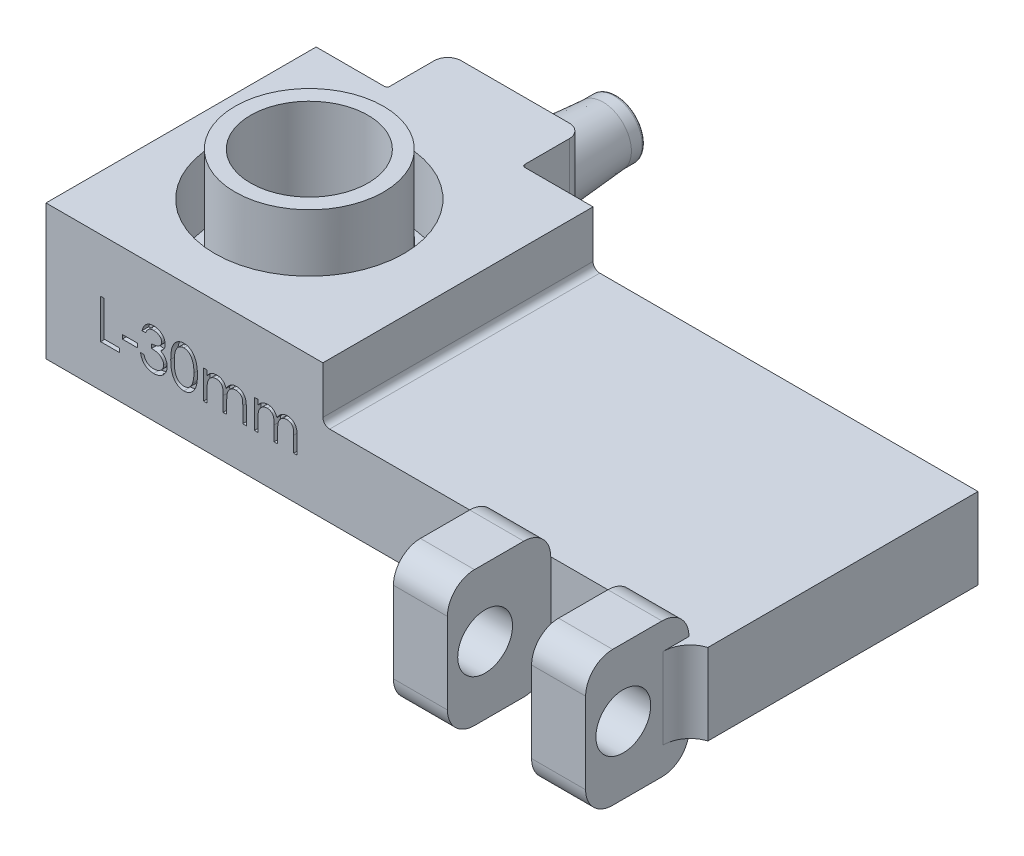
from build123d import *

# Parameters (mm, degrees)
SKETCH2_W            = 49
SKETCH2_H            = 20
BOSS_EXTRUDE1_DEPTH  = 10
SKETCH3_W            = 30
SKETCH3_H            = 3.02
CUT_EXTRUDE1_DEPTH   = 2
SKETCH4_W            = 5
SKETCH4_H            = 5
CUT_EXTRUDE2_DEPTH   = 5
SKETCH5_R            = 7
CUT_EXTRUDE3_DEPTH   = 38.474986727
SKETCH6_W            = 1.65
SKETCH6_H            = 5
BOSS_EXTRUDE2_DEPTH  = 0.5
SKETCH11_R           = 2
CUT_EXTRUDE4_DEPTH   = 2
SKETCH12_W           = 5
SKETCH12_H           = 5
BOSS_EXTRUDE4_DEPTH  = 0.8
SKETCH14_W           = 28.5
SKETCH14_H           = 4
CUT_EXTRUDE6_DEPTH   = 42.177221974
FILLET1_R            = 0.5
SKETCH13_W           = 1.119391026
SKETCH13_H           = 0.298504274
CUT_EXTRUDE5_DEPTH   = 0.5
SKETCH19_W           = 10
SKETCH19_H           = 4.49
BOSS_EXTRUDE5_DEPTH  = 10
FILLET2_R            = 1
CUT_EXTRUDE7_REACH   = 45.535
SKETCH20_R           = 0.5
SKETCH21_R           = 1.4
CUT_EXTRUDE8_DEPTH   = 10
FILLET3_R            = 0.2
BOSS_EXTRUDE6_START  = -0.5
SKETCH24_W           = 1.7
SKETCH24_H           = 3
BOSS_EXTRUDE6_DEPTH  = 0.5
SKETCH31_W           = 4
SKETCH31_H           = 10
BOSS_EXTRUDE9_DEPTH  = 7.65
CUT_EXTRUDE11_REACH  = 57.175
SKETCH33_R           = 2.03
FILLET4_R            = 2
FILLET5_R            = 2
SKETCH34_R           = 5.5
SKETCH34_R_2         = 4.35
BOSS_EXTRUDE10_DEPTH = 8.2


# Some blends are built 0.0001 mm under size
with BuildPart() as part:
    # Sketch2 → Boss-Extrude1 (new body)
    with BuildSketch(Plane(origin=(0, 0, 0), x_dir=(1, 0, 0), z_dir=(0, 1, 0))):
        with Locations((10.076923077, 3.557692308)):
            Rectangle(SKETCH2_W, SKETCH2_H)
    extrude(amount=BOSS_EXTRUDE1_DEPTH)

    # Sketch3 → Cut-Extrude1 (cut)
    with BuildSketch(Plane.XZ):
        with Locations((12.576923077, -3.557692308)):
            Rectangle(SKETCH3_W, SKETCH3_H)
    extrude(amount=-CUT_EXTRUDE1_DEPTH, mode=Mode.SUBTRACT)

    # Sketch4 → Cut-Extrude2 (cut)
    with BuildSketch(Plane.XZ):
        with Locations((-4.923076923, -3.547692308)):
            Rectangle(SKETCH4_W, SKETCH4_H)
    extrude(amount=-CUT_EXTRUDE2_DEPTH, mode=Mode.SUBTRACT)

    # Sketch5 → Cut-Extrude3 (cut, through all)
    with BuildSketch(Plane.XZ.offset(-5)):
        with Locations(Location((-4.923076923, -3.552692308, 0), (0, 0, 270))):
            Circle(SKETCH5_R)
    extrude(amount=-CUT_EXTRUDE3_DEPTH, mode=Mode.SUBTRACT)

    # Sketch6 → Boss-Extrude2 (add)
    with BuildSketch(Plane(origin=(0, 5, 0), x_dir=(1, 0, 0), z_dir=(0, 1, 0))):
        with Locations((-3.248076923, 3.547692308)):
            Rectangle(SKETCH6_W, SKETCH6_H)
        with Locations((-6.598076923, 3.547692308)):
            Rectangle(SKETCH6_W, SKETCH6_H)
    extrude(amount=-BOSS_EXTRUDE2_DEPTH)

    # Sketch11 → Cut-Extrude4 (cut)
    with BuildSketch(Plane.XZ):
        with Locations((28.888372657, -3.557692308)):
            Circle(SKETCH11_R)
    extrude(amount=-CUT_EXTRUDE4_DEPTH, mode=Mode.SUBTRACT)

    # Sketch12 → Boss-Extrude4 (add)
    with BuildSketch(Plane.XZ):
        with Locations((-4.923076923, -3.547692308)):
            Rectangle(SKETCH12_W, SKETCH12_H)
    extrude(amount=-BOSS_EXTRUDE4_DEPTH)

    # Sketch14 → Cut-Extrude6 (cut, through all)
    with BuildSketch(Plane.XY.offset(6.442307692)):
        with Locations((20.326923077, 8)):
            Rectangle(SKETCH14_W, SKETCH14_H)
    extrude(amount=-CUT_EXTRUDE6_DEPTH, mode=Mode.SUBTRACT)

    # Fillet1
    fillet1_edges = [part.edges().sort_by_distance(p)[0] for p in [
        (6.076923077, 6, -3.557692308),
    ]]
    fillet(fillet1_edges, radius=FILLET1_R)

    # Sketch13 → Cut-Extrude5 (cut)
    # profile 1 of 6: a face of its own
    with BuildSketch(Plane.XY.offset(6.442307692)):
        Polygon((-10.374825021, 6.036177607), (-10.113633781, 6.036177607), (-10.113633781, 3.424265214), (-8.994242756, 3.424265214), (-8.994242756, 3.12576094), (-10.374825021, 3.12576094), align=None)
    # profile 2 of 6: a face of its own
    with BuildSketch(Plane.XY.offset(6.442307692)):
        with Locations((-8.210669038, 4.245151966)):
            Rectangle(SKETCH13_W, SKETCH13_H)
    # profile 3 of 6: a face of its own
    with BuildSketch(Plane.XY.offset(6.442307692)):
        with BuildLine():
            Line((-7.053964978, 5.364542992), (-7.315156217, 5.364542992))
            add(Edge.make_bspline(
                [(-7.315156217, 5.364542992), (-7.308080121, 5.39384048), (-7.294246931, 5.451114673), (-7.265394246, 5.532944996), (-7.233962365, 5.610381639), (-7.196219163, 5.681974624), (-7.155050277, 5.749162759), (-7.107882633, 5.810422144), (-7.056892363, 5.867310783), (-7.000492688, 5.917796731), (-6.941345819, 5.963513331), (-6.878618341, 6.002492173), (-6.81357228, 6.036023626), (-6.745756966, 6.063647831), (-6.674970501, 6.084457746), (-6.601852832, 6.099555994), (-6.52621235, 6.109360867), (-6.474866288, 6.110317781), (-6.448794205, 6.110803675)],
                knots=[0, 0, 0, 0, 1.162005537, 2.271625781, 3.343758855, 4.383309926, 5.390229558, 6.379919256, 7.361854164, 8.333198761, 9.295911338, 10.242430842, 11.177959212, 12.116337295, 13.062827104, 14.020064771, 14.994644689, 16, 16, 16, 16], degree=3))
            add(Edge.make_bspline(
                [(-6.448794205, 6.110803675), (-6.410806829, 6.10965678), (-6.335660693, 6.107388006), (-6.225261898, 6.086670465), (-6.118801501, 6.05388659), (-6.017444787, 6.008589092), (-5.923298269, 5.952719642), (-5.839531333, 5.886225155), (-5.767279399, 5.810388593), (-5.706664253, 5.726624669), (-5.659203673, 5.637103987), (-5.624206849, 5.54496838), (-5.602901202, 5.450436407), (-5.60014, 5.386609075), (-5.598756645, 5.354631717)],
                knots=[0, 0, 0, 0, 1.083050992, 2.142477498, 3.193116406, 4.255571735, 5.30263384, 6.308962982, 7.297363603, 8.282367274, 9.249857812, 10.179914175, 11.08814088, 12, 12, 12, 12], degree=3))
            add(Edge.make_bspline(
                [(-5.598756645, 5.354631717), (-5.599724226, 5.323858805), (-5.601617633, 5.263640992), (-5.617694529, 5.175728532), (-5.644749981, 5.092871797), (-5.682227635, 5.014721985), (-5.730741412, 4.941774604), (-5.789509125, 4.873865526), (-5.858945565, 4.810693554), (-5.911565015, 4.77450504), (-5.938655065, 4.755874122)],
                knots=[0, 0, 0, 0, 1.024540389, 2.004866551, 2.965041327, 3.920577974, 4.882998113, 5.874504559, 6.905732034, 8, 8, 8, 8], degree=3))
            add(Edge.make_bspline(
                [(-5.938655065, 4.755874122), (-5.907695089, 4.740924416), (-5.84635442, 4.711304725), (-5.762741866, 4.653216336), (-5.686839967, 4.586146742), (-5.6445111, 4.533806929), (-5.623243323, 4.507509238)],
                knots=[0, 0, 0, 0, 1.015518401, 2.012035669, 3.001164323, 4, 4, 4, 4], degree=3))
            add(Edge.make_bspline(
                [(-5.623243323, 4.507509238), (-5.609238945, 4.488335619), (-5.58145952, 4.450302364), (-5.54717021, 4.389153324), (-5.51606275, 4.32732652), (-5.491822955, 4.2631648), (-5.47305171, 4.197411823), (-5.459633831, 4.129954688), (-5.45129828, 4.060738309), (-5.45010455, 4.0139118), (-5.449504508, 3.990373905)],
                knots=[0, 0, 0, 0, 1.025084078, 2.033381695, 3.024893161, 4.013698104, 4.991890475, 5.976764909, 6.982997093, 8, 8, 8, 8], degree=3))
            add(Edge.make_bspline(
                [(-5.449504508, 3.990373905), (-5.450996731, 3.949619988), (-5.453974156, 3.868303942), (-5.480587068, 3.748166331), (-5.52184284, 3.630730601), (-5.580431137, 3.51840944), (-5.65183406, 3.413318135), (-5.736782739, 3.3192898), (-5.834311973, 3.238464532), (-5.943083099, 3.17093436), (-6.06092764, 3.116952016), (-6.186969962, 3.079484607), (-6.319393965, 3.055082011), (-6.410205034, 3.05246524), (-6.456373415, 3.051134872)],
                knots=[0, 0, 0, 0, 0.955779014, 1.907060117, 2.875433937, 3.871313158, 4.872415639, 5.851225146, 6.836215519, 7.83643374, 8.849228613, 9.86973379, 10.916971861, 12, 12, 12, 12], degree=3))
            add(Edge.make_bspline(
                [(-6.456373415, 3.051134872), (-6.487489345, 3.051856833), (-6.548715119, 3.053277411), (-6.638724743, 3.062988724), (-6.724641656, 3.080725639), (-6.806582024, 3.104593804), (-6.88461864, 3.13485527), (-6.958513375, 3.172539926), (-7.028720852, 3.216870978), (-7.094578551, 3.268371706), (-7.156078622, 3.325982439), (-7.211586691, 3.390725913), (-7.262028198, 3.461405302), (-7.306052523, 3.538841558), (-7.345664917, 3.622033953), (-7.378245749, 3.712047734), (-7.406922141, 3.808078198), (-7.42025473, 3.874999271), (-7.42709532, 3.909334658)],
                knots=[0, 0, 0, 0, 1.048658725, 2.063410685, 3.046034179, 4.001477787, 4.936774919, 5.862367409, 6.792675028, 7.730719943, 8.675894397, 9.627829632, 10.600096036, 11.597688215, 12.626045268, 13.701542398, 14.82072376, 16, 16, 16, 16], degree=3))
            Line((-7.42709532, 3.909334658), (-7.16590408, 3.909334658))
            add(Edge.make_bspline(
                [(-7.16590408, 3.909334658), (-7.159099284, 3.886925271), (-7.145863364, 3.843337065), (-7.123333165, 3.780604858), (-7.097664727, 3.723096644), (-7.070128394, 3.67039056), (-7.04120846, 3.621967544), (-7.008848847, 3.579108025), (-6.97544629, 3.539929491), (-6.950267566, 3.517856382), (-6.937944762, 3.507053509)],
                knots=[0, 0, 0, 0, 1.198163088, 2.33053128, 3.407730985, 4.417276592, 5.372219308, 6.28897303, 7.162600585, 8, 8, 8, 8], degree=3))
            add(Edge.make_bspline(
                [(-6.937944762, 3.507053509), (-6.921649276, 3.494490209), (-6.889108603, 3.469402391), (-6.836082282, 3.437386454), (-6.780314636, 3.409645173), (-6.720597315, 3.388454266), (-6.658218961, 3.370511414), (-6.592171324, 3.35876953), (-6.523037106, 3.350713354), (-6.475832008, 3.350002438), (-6.451709285, 3.349639146)],
                knots=[0, 0, 0, 0, 0.946170439, 1.889420265, 2.845303464, 3.807233317, 4.801018734, 5.828864929, 6.890507805, 8, 8, 8, 8], degree=3))
            add(Edge.make_bspline(
                [(-6.451709285, 3.349639146), (-6.424473188, 3.3501513), (-6.371215352, 3.351152774), (-6.293503186, 3.360362752), (-6.219572409, 3.373775959), (-6.150243852, 3.39449229), (-6.084609376, 3.420088034), (-6.02358904, 3.452226023), (-5.966381802, 3.489932319), (-5.913720385, 3.532789583), (-5.866367484, 3.579706743), (-5.824674091, 3.628778922), (-5.789229656, 3.679799216), (-5.760638073, 3.733049963), (-5.738061098, 3.78831065), (-5.722691436, 3.845736356), (-5.712004789, 3.904857118), (-5.711134482, 3.945044957), (-5.710695747, 3.96530421)],
                knots=[0, 0, 0, 0, 1.217147791, 2.380027433, 3.494444702, 4.572153297, 5.609568379, 6.639424714, 7.649109417, 8.668170816, 9.669597737, 10.625200337, 11.543417969, 12.441394052, 13.322311151, 14.205496177, 15.095365482, 16, 16, 16, 16], degree=3))
            add(Edge.make_bspline(
                [(-5.710695747, 3.96530421), (-5.711968266, 3.992422091), (-5.714506971, 4.046522918), (-5.733889165, 4.126116639), (-5.765769756, 4.202804798), (-5.810401005, 4.275278988), (-5.864730775, 4.342447997), (-5.928231831, 4.402378866), (-6.001431495, 4.451831079), (-6.068803374, 4.485998253), (-6.128479519, 4.509312417), (-6.179549336, 4.524841539), (-6.236723726, 4.537991347), (-6.299311279, 4.550225301), (-6.367783584, 4.560637398), (-6.442066097, 4.569320265), (-6.522173871, 4.57626788), (-6.577630751, 4.579370463), (-6.606208568, 4.580969274)],
                knots=[0, 0, 0, 0, 1.07054697, 2.135767047, 3.216561865, 4.33974944, 5.486079747, 6.621378074, 7.775625952, 8.963672916, 9.598146892, 10.304877434, 11.070270905, 11.915000392, 12.823868403, 13.805723172, 14.86925407, 16, 16, 16, 16], degree=3))
            Line((-6.606208568, 4.580969274), (-6.606208568, 4.879473547))
            add(Edge.make_bspline(
                [(-6.606208568, 4.879473547), (-6.570201586, 4.880084572), (-6.499672755, 4.881281418), (-6.396648741, 4.895757008), (-6.298132541, 4.915781197), (-6.206307446, 4.94645299), (-6.122613248, 4.982076737), (-6.050002841, 5.023531223), (-5.989493493, 5.069611226), (-5.941379257, 5.121027985), (-5.90518263, 5.176172105), (-5.878717133, 5.233645897), (-5.863083766, 5.293953107), (-5.860996859, 5.335110281), (-5.859947884, 5.355797749)],
                knots=[0, 0, 0, 0, 1.321986639, 2.589447074, 3.816329219, 5.01088745, 6.139805852, 7.153945165, 8.075214402, 8.924034688, 9.728124013, 10.488707548, 11.240355623, 12, 12, 12, 12], degree=3))
            add(Edge.make_bspline(
                [(-5.859947884, 5.355797749), (-5.860292486, 5.370996565), (-5.860978057, 5.401233887), (-5.869623888, 5.445409912), (-5.882616022, 5.488235401), (-5.90047744, 5.529528235), (-5.924384599, 5.569002028), (-5.952994815, 5.606993317), (-5.987061742, 5.643285198), (-6.026099116, 5.677112821), (-6.068018933, 5.709351287), (-6.113961752, 5.736720544), (-6.162542322, 5.760124503), (-6.21381443, 5.779424309), (-6.267944463, 5.793942539), (-6.324678095, 5.804366688), (-6.384123508, 5.810884071), (-6.424679526, 5.811822403), (-6.445296108, 5.812299402)],
                knots=[0, 0, 0, 0, 0.884392785, 1.759457502, 2.611959086, 3.489218968, 4.37281399, 5.2945488, 6.255912374, 7.266815255, 8.301784654, 9.332968512, 10.37626691, 11.440494194, 12.520033166, 13.637162961, 14.798855837, 16, 16, 16, 16], degree=3))
            add(Edge.make_bspline(
                [(-6.445296108, 5.812299402), (-6.478434667, 5.811142418), (-6.543161982, 5.80888256), (-6.636474029, 5.789089221), (-6.723220523, 5.757508636), (-6.789527021, 5.719812071), (-6.838490685, 5.682599955), (-6.873479663, 5.650101089), (-6.907839635, 5.613984628), (-6.939310118, 5.572026086), (-6.971136752, 5.527066976), (-7.000111664, 5.476821807), (-7.02826761, 5.422601248), (-7.045233302, 5.384270533), (-7.053964978, 5.364542992)],
                knots=[0, 0, 0, 0, 1.472543308, 2.876219568, 4.221790263, 5.565193594, 6.249813518, 6.953379497, 7.687249741, 8.463570142, 9.283606569, 10.136032583, 11.040678096, 12, 12, 12, 12], degree=3))
        make_face()
    # profile 4 of 6: a face of its own
    with BuildSketch(Plane.XY.offset(6.442307692)):
        with BuildLine():
            add(Edge.make_bspline(
                [(-5.188313269, 4.579803241), (-5.188040506, 4.626450891), (-5.18751066, 4.717064622), (-5.181616301, 4.849101613), (-5.171824543, 4.972969186), (-5.158405549, 5.088673272), (-5.142075633, 5.196243739), (-5.120276208, 5.295393117), (-5.095485443, 5.386580302), (-5.066753439, 5.470102648), (-5.034333236, 5.547085417), (-4.999047127, 5.618952087), (-4.959494735, 5.68559392), (-4.917936553, 5.748074571), (-4.872690324, 5.805371274), (-4.825043651, 5.858293179), (-4.773136889, 5.905617178), (-4.718734542, 5.948729847), (-4.661344065, 5.986523247), (-4.602601324, 6.019812376), (-4.542101989, 6.048251194), (-4.479680884, 6.070611872), (-4.415899054, 6.089081248), (-4.350533535, 6.101711582), (-4.283476401, 6.109658606), (-4.238214071, 6.110418364), (-4.215259299, 6.110803675)],
                knots=[0, 0, 0, 0, 1.646270934, 3.197905019, 4.663502075, 6.030701355, 7.308322542, 8.50163776, 9.611534131, 10.641858119, 11.616356847, 12.558055219, 13.465016945, 14.349605745, 15.204443733, 16.039544428, 16.859896111, 17.680448484, 18.487036065, 19.28249412, 20.06191084, 20.843045899, 21.620316918, 22.403196591, 23.190181807, 24, 24, 24, 24], degree=3))
            add(Edge.make_bspline(
                [(-4.215259299, 6.110803675), (-4.192112773, 6.110398034), (-4.146081616, 6.109591341), (-4.078027446, 6.101838038), (-4.011545479, 6.088973063), (-3.946919146, 6.070744729), (-3.883617594, 6.048130228), (-3.822135951, 6.019785167), (-3.762092324, 5.9867903), (-3.704440888, 5.948020325), (-3.648548735, 5.904794587), (-3.595788733, 5.85593063), (-3.546156078, 5.801921846), (-3.499027863, 5.743346081), (-3.455741155, 5.679079853), (-3.414518486, 5.610240924), (-3.377621025, 5.535625437), (-3.342085107, 5.456478345), (-3.311411821, 5.370609696), (-3.283749354, 5.278503523), (-3.261398212, 5.179071893), (-3.242780466, 5.072836491), (-3.228357359, 4.959407173), (-3.217852716, 4.839027088), (-3.212303728, 4.711617037), (-3.211258721, 4.624505897), (-3.210722457, 4.579803241)],
                knots=[0, 0, 0, 0, 0.810914788, 1.612654377, 2.396697861, 3.181598691, 3.963628158, 4.749916497, 5.551656086, 6.361998678, 7.18212741, 8.025565596, 8.878627764, 9.750805457, 10.657531673, 11.591944965, 12.560506719, 13.57287815, 14.630710178, 15.753379473, 16.941251878, 18.199788006, 19.531962791, 20.947069417, 22.433333509, 24, 24, 24, 24], degree=3))
            add(Edge.make_bspline(
                [(-3.210722457, 4.579803241), (-3.21126428, 4.535295563), (-3.212320001, 4.448574167), (-3.217790509, 4.321737398), (-3.228566228, 4.201996168), (-3.242045605, 4.089063301), (-3.26071465, 3.983408841), (-3.28366966, 3.884667177), (-3.309156863, 3.792411899), (-3.340618296, 3.707398785), (-3.375053274, 3.628441906), (-3.412518815, 3.554710949), (-3.452657474, 3.485554217), (-3.49638752, 3.421525261), (-3.542998602, 3.362170508), (-3.593488335, 3.308537664), (-3.646433458, 3.259334432), (-3.702490092, 3.215552097), (-3.76104065, 3.177230387), (-3.820878049, 3.142959108), (-3.883063993, 3.11532454), (-3.946189228, 3.091596294), (-4.011156685, 3.07346818), (-4.07788538, 3.060933552), (-4.146035893, 3.052142556), (-4.192104933, 3.05147193), (-4.215259299, 3.051134872)],
                knots=[0, 0, 0, 0, 1.561518951, 3.042555995, 4.452378317, 5.7783523, 7.031515105, 8.214008947, 9.334062868, 10.386615937, 11.391082383, 12.354592575, 13.286541444, 14.194233754, 15.072674879, 15.931287219, 16.775624067, 17.606195743, 18.42308326, 19.229000347, 20.022332153, 20.807536673, 21.593273796, 22.3848459, 23.188221202, 24, 24, 24, 24], degree=3))
            add(Edge.make_bspline(
                [(-4.215259299, 3.051134872), (-4.238213434, 3.051522669), (-4.283474508, 3.052287328), (-4.350540841, 3.060198449), (-4.41563642, 3.072917388), (-4.479082467, 3.090726315), (-4.541204492, 3.112525199), (-4.601155988, 3.140925614), (-4.659603544, 3.173633765), (-4.716391225, 3.210883291), (-4.770451932, 3.253559714), (-4.82208988, 3.300761924), (-4.870007827, 3.35366782), (-4.914607132, 3.411442021), (-4.956994513, 3.473553009), (-4.99598526, 3.540848805), (-5.03205019, 3.613062571), (-5.065015641, 3.690660857), (-5.094243428, 3.774775997), (-5.120061076, 3.866370284), (-5.140445765, 3.966252155), (-5.157894092, 4.073619394), (-5.171967522, 4.188933371), (-5.181575494, 4.312256688), (-5.187513837, 4.443512495), (-5.188041929, 4.533543968), (-5.188313269, 4.579803241)],
                knots=[0, 0, 0, 0, 0.810891512, 1.598919785, 2.382837074, 3.152667961, 3.926044502, 4.706494248, 5.493654104, 6.291793342, 7.103789334, 7.925228297, 8.761435821, 9.622817696, 10.50288917, 11.416980706, 12.369136599, 13.353924996, 14.394355917, 15.514179734, 16.714354668, 17.994756427, 19.357759367, 20.818452758, 22.365282078, 24, 24, 24, 24], degree=3))
        make_face()
        with BuildLine():
            add(Edge.make_bspline(
                [(-4.927122029, 4.580969274), (-4.927022703, 4.542095505), (-4.926829931, 4.466649152), (-4.921793912, 4.357015202), (-4.914933451, 4.254759518), (-4.906084706, 4.159752262), (-4.892943802, 4.072315019), (-4.878219764, 3.99184642), (-4.860301502, 3.918772312), (-4.83910118, 3.852591258), (-4.814953788, 3.792180098), (-4.788588853, 3.735966468), (-4.76026574, 3.683286317), (-4.728567851, 3.634612834), (-4.694046099, 3.589787291), (-4.65748024, 3.548016299), (-4.617505597, 3.510765476), (-4.562204568, 3.466089038), (-4.489197619, 3.419922234), (-4.397211443, 3.379720158), (-4.302690713, 3.354455699), (-4.238535775, 3.351242802), (-4.206514056, 3.349639146)],
                knots=[0, 0, 0, 0, 1.459021318, 2.831673884, 4.118529203, 5.306027144, 6.411944654, 7.436330062, 8.375795394, 9.233974572, 10.042671642, 10.816086306, 11.563610507, 12.285937304, 12.993564865, 13.685989202, 14.367179055, 15.041617293, 16.353048772, 17.594441528, 18.799311195, 20, 20, 20, 20], degree=3))
            add(Edge.make_bspline(
                [(-4.206514056, 3.349639146), (-4.174285207, 3.350967776), (-4.109894048, 3.353622295), (-4.01581791, 3.379232912), (-3.924488811, 3.417874547), (-3.852915894, 3.463566014), (-3.798464041, 3.507079512), (-3.759450329, 3.544178716), (-3.723642185, 3.585719399), (-3.689680055, 3.63053923), (-3.65853105, 3.679494504), (-3.630205929, 3.732349812), (-3.604358645, 3.789251932), (-3.58963273, 3.828974745), (-3.58210375, 3.849283994)],
                knots=[0, 0, 0, 0, 1.353760809, 2.704726607, 4.075137775, 5.516104923, 6.260822281, 7.007110065, 7.778089737, 8.566572457, 9.372053459, 10.217411131, 11.088608312, 12, 12, 12, 12], degree=3))
            add(Edge.make_bspline(
                [(-3.58210375, 3.849283994), (-3.573329453, 3.875253009), (-3.555513866, 3.927981248), (-3.532553361, 4.009775309), (-3.514471026, 4.095593321), (-3.498203156, 4.184922421), (-3.487099454, 4.278421387), (-3.478162135, 4.375800922), (-3.472897868, 4.477134447), (-3.47224531, 4.545982425), (-3.471913696, 4.580969274)],
                knots=[0, 0, 0, 0, 0.884706709, 1.796334032, 2.740027952, 3.714592787, 4.726048262, 5.777819803, 6.87074269, 8, 8, 8, 8], degree=3))
            add(Edge.make_bspline(
                [(-3.471913696, 4.580969274), (-3.472371204, 4.615950464), (-3.473266189, 4.684381149), (-3.476687166, 4.784597755), (-3.485521174, 4.879783149), (-3.495332703, 4.970347393), (-3.509799321, 5.055789163), (-3.52539733, 5.136823732), (-3.546353338, 5.212447188), (-3.568738413, 5.283843519), (-3.594358724, 5.350201563), (-3.622561272, 5.411830705), (-3.65268139, 5.46902848), (-3.685396336, 5.521637954), (-3.720317746, 5.569894777), (-3.758367327, 5.612831401), (-3.798035785, 5.651778571), (-3.853597457, 5.696235243), (-3.926336494, 5.741564313), (-4.016846833, 5.783279531), (-4.111036768, 5.807234999), (-4.174711241, 5.810612485), (-4.206514056, 5.812299402)],
                knots=[0, 0, 0, 0, 1.31362396, 2.569729283, 3.763502607, 4.902122613, 5.988968491, 7.01645872, 7.998833611, 8.933434873, 9.825090667, 10.667526885, 11.477055099, 12.250526234, 12.991942729, 13.710640831, 14.402115721, 15.076753259, 16.378508321, 17.609869233, 18.806226677, 20, 20, 20, 20], degree=3))
            add(Edge.make_bspline(
                [(-4.206514056, 5.812299402), (-4.238703757, 5.810610157), (-4.3031418, 5.807228591), (-4.398310725, 5.783368784), (-4.489535117, 5.741780621), (-4.562081805, 5.696085107), (-4.617682227, 5.652563309), (-4.656833729, 5.614822311), (-4.693543373, 5.573539086), (-4.727360503, 5.528301303), (-4.759033555, 5.479684566), (-4.788121933, 5.427306409), (-4.814330094, 5.3709014), (-4.83851527, 5.310517376), (-4.859780261, 5.244342031), (-4.877320896, 5.171357933), (-4.893525309, 5.091145277), (-4.904996732, 5.003234472), (-4.915194629, 4.908203419), (-4.921748345, 4.805692459), (-4.926846777, 4.695874637), (-4.927028441, 4.620038194), (-4.927122029, 4.580969274)],
                knots=[0, 0, 0, 0, 1.207732386, 2.417664972, 3.655092373, 4.956220595, 5.625982001, 6.301752483, 6.994047911, 7.697131622, 8.419323945, 9.170223765, 9.943494443, 10.752040957, 11.610060368, 12.549350801, 13.567764191, 14.679664412, 15.874934091, 17.154273443, 18.533957287, 20, 20, 20, 20], degree=3))
        make_face(mode=Mode.SUBTRACT)
    # profile 5 of 6: a face of its own
    with BuildSketch(Plane.XY.offset(6.442307692)):
        with BuildLine():
            Line((-2.762966046, 5.252603889), (-2.501774807, 5.252603889))
            Line((-2.501774807, 5.252603889), (-2.501774807, 4.882971644))
            add(Edge.make_bspline(
                [(-2.501774807, 4.882971644), (-2.478255356, 4.915308537), (-2.433189832, 4.977269123), (-2.359293811, 5.05891902), (-2.285472246, 5.128210349), (-2.232308594, 5.16458463), (-2.20676863, 5.182058934)],
                knots=[0, 0, 0, 0, 1.134379233, 2.173579362, 3.122582517, 4, 4, 4, 4], degree=3))
            add(Edge.make_bspline(
                [(-2.20676863, 5.182058934), (-2.17195617, 5.198694348), (-2.102939464, 5.231674535), (-1.993658121, 5.265130655), (-1.88183603, 5.285690755), (-1.806324675, 5.288502528), (-1.768340479, 5.289916923)],
                knots=[0, 0, 0, 0, 1.014936303, 2.012140481, 3.000054389, 4, 4, 4, 4], degree=3))
            add(Edge.make_bspline(
                [(-1.768340479, 5.289916923), (-1.742651481, 5.289047714), (-1.691814336, 5.287327596), (-1.616489351, 5.276134936), (-1.543430732, 5.256788005), (-1.473070137, 5.229839772), (-1.406778596, 5.197204283), (-1.346001448, 5.158911758), (-1.291431794, 5.115923178), (-1.243097214, 5.066297304), (-1.199633031, 5.00864062), (-1.15965318, 4.941398147), (-1.122711501, 4.86305999), (-1.10223771, 4.806209956), (-1.091458718, 4.776279687)],
                knots=[0, 0, 0, 0, 1.009824226, 1.998387844, 2.986035974, 3.974953746, 4.955485308, 5.885931332, 6.793869504, 7.679848016, 8.601185859, 9.625726857, 10.749998409, 12, 12, 12, 12], degree=3))
            add(Edge.make_bspline(
                [(-1.091458718, 4.776279687), (-1.080057159, 4.796839219), (-1.057620494, 4.837297491), (-1.019946699, 4.894556415), (-0.980474966, 4.948113729), (-0.938868902, 4.998011928), (-0.895275362, 5.044004603), (-0.849489186, 5.086243814), (-0.801771007, 5.124910956), (-0.73541996, 5.17008325), (-0.649094834, 5.21806453), (-0.540255134, 5.259665564), (-0.427039783, 5.285373797), (-0.350190066, 5.288392541), (-0.311383097, 5.289916923)],
                knots=[0, 0, 0, 0, 0.86119277, 1.694706429, 2.50939023, 3.298075842, 4.073795165, 4.829715201, 5.57930267, 6.321991688, 7.768977793, 9.186738141, 10.579381044, 12, 12, 12, 12], degree=3))
            add(Edge.make_bspline(
                [(-0.311383097, 5.289916923), (-0.275725119, 5.288572127), (-0.205938993, 5.285940231), (-0.104342778, 5.265273384), (-0.009594742, 5.229784888), (0.07811447, 5.181360846), (0.157244386, 5.120508871), (0.226026936, 5.048106986), (0.284044316, 4.964667317), (0.321945125, 4.886175883), (0.347652639, 4.816878586), (0.363502963, 4.757833473), (0.377505972, 4.692846735), (0.389132043, 4.621840667), (0.397629256, 4.544564441), (0.403924666, 4.461144518), (0.408185577, 4.371516065), (0.408486658, 4.309677611), (0.40864186, 4.277800871)],
                knots=[0, 0, 0, 0, 1.209669288, 2.367440248, 3.500751976, 4.631527125, 5.755587489, 6.87532382, 8.007944318, 9.190864318, 9.82315674, 10.514484317, 11.263564316, 12.079023757, 12.955305781, 13.901327259, 14.918167583, 16, 16, 16, 16], degree=3))
            Line((0.40864186, 4.277800871), (0.40864186, 3.12576094))
            Line((0.40864186, 3.12576094), (0.14745062, 3.12576094))
            Line((0.14745062, 3.12576094), (0.14745062, 4.278966903))
            add(Edge.make_bspline(
                [(0.14745062, 4.278966903), (0.147385857, 4.306175619), (0.147261392, 4.358466632), (0.145021509, 4.433515843), (0.140801143, 4.501925899), (0.135866209, 4.563603522), (0.129011089, 4.618692545), (0.120158489, 4.667082312), (0.110780561, 4.709153475), (0.095200693, 4.755791695), (0.070297595, 4.807239721), (0.032364488, 4.862723551), (-0.015424642, 4.911020502), (-0.070606272, 4.952945734), (-0.133428402, 4.987033898), (-0.202666984, 5.011378295), (-0.277892151, 5.026448331), (-0.329965981, 5.027950119), (-0.356858357, 5.028725684)],
                knots=[0, 0, 0, 0, 1.253487763, 2.409012846, 3.458416907, 4.410876679, 5.259312806, 6.014470957, 6.676830364, 7.243083969, 8.276244668, 9.299465089, 10.325150304, 11.392391894, 12.482080715, 13.603491619, 14.762376348, 16, 16, 16, 16], degree=3))
            add(Edge.make_bspline(
                [(-0.356858357, 5.028725684), (-0.389845813, 5.027548082), (-0.455041568, 5.025220692), (-0.550208439, 5.001460156), (-0.641654576, 4.965636876), (-0.726651327, 4.913721315), (-0.804839912, 4.851514598), (-0.872111763, 4.777548774), (-0.927685908, 4.693870197), (-0.965316744, 4.616414279), (-0.989090109, 4.546839152), (-1.004787164, 4.486055206), (-1.016997103, 4.416968926), (-1.028447954, 4.340044543), (-1.035921678, 4.254752553), (-1.042714068, 4.161487502), (-1.045891298, 4.059968876), (-1.046335725, 3.989597755), (-1.046566474, 3.95306087)],
                knots=[0, 0, 0, 0, 1.090531906, 2.155305635, 3.229839962, 4.33261226, 5.44038871, 6.529323825, 7.629011124, 8.757537029, 9.370236727, 10.061839251, 10.834451254, 11.692844982, 12.636905849, 13.66920014, 14.789842145, 16, 16, 16, 16], degree=3))
            Line((-1.046566474, 3.95306087), (-1.046566474, 3.12576094))
            Line((-1.046566474, 3.12576094), (-1.307757713, 3.12576094))
            Line((-1.307757713, 3.12576094), (-1.307757713, 4.207255916))
            add(Edge.make_bspline(
                [(-1.307757713, 4.207255916), (-1.307823764, 4.237768158), (-1.307950838, 4.296470644), (-1.310176324, 4.380651266), (-1.314406092, 4.457221069), (-1.319296048, 4.52609106), (-1.326331089, 4.587136075), (-1.334322064, 4.640683383), (-1.343758974, 4.686598741), (-1.359383658, 4.736960079), (-1.383261106, 4.792441704), (-1.421668845, 4.851598851), (-1.469572291, 4.903377739), (-1.525760692, 4.94758177), (-1.588963036, 4.984121204), (-1.658799233, 5.010447795), (-1.734640461, 5.025768469), (-1.786926268, 5.027721356), (-1.813815739, 5.028725684)],
                knots=[0, 0, 0, 0, 1.320475261, 2.540461679, 3.643808994, 4.639130445, 5.527981419, 6.302341397, 6.981980563, 7.553956391, 8.582137848, 9.585246428, 10.591171744, 11.620968678, 12.668337649, 13.738356861, 14.836885341, 16, 16, 16, 16], degree=3))
            add(Edge.make_bspline(
                [(-1.813815739, 5.028725684), (-1.845428029, 5.027453034), (-1.908430201, 5.024916687), (-2.000983089, 5.002087151), (-2.090362553, 4.966327215), (-2.17514274, 4.916717234), (-2.253037255, 4.855266631), (-2.321231034, 4.782992757), (-2.378560027, 4.700795078), (-2.416588209, 4.624155894), (-2.441117595, 4.556323831), (-2.457412049, 4.498655216), (-2.471415, 4.434625843), (-2.481821005, 4.364038168), (-2.491866446, 4.287351936), (-2.496714625, 4.204185126), (-2.501430799, 4.11460908), (-2.501657325, 4.052764767), (-2.501774807, 4.020690745)],
                knots=[0, 0, 0, 0, 1.098833095, 2.189935336, 3.297829714, 4.440610912, 5.596351641, 6.740013378, 7.886572111, 9.072425424, 9.705826452, 10.395263256, 11.156850408, 11.985370555, 12.878090359, 13.847760091, 14.883794034, 16, 16, 16, 16], degree=3))
            Line((-2.501774807, 4.020690745), (-2.501774807, 3.12576094))
            Line((-2.501774807, 3.12576094), (-2.762966046, 3.12576094))
            Line((-2.762966046, 3.12576094), (-2.762966046, 5.252603889))
        make_face()
    # profile 6 of 6: a face of its own
    with BuildSketch(Plane.XY.offset(6.442307692)):
        with BuildLine():
            Line((1.005650407, 5.252603889), (1.266841646, 5.252603889))
            Line((1.266841646, 5.252603889), (1.266841646, 4.882971644))
            add(Edge.make_bspline(
                [(1.266841646, 4.882971644), (1.290361097, 4.915308537), (1.335426621, 4.977269123), (1.409322642, 5.05891902), (1.483144207, 5.128210349), (1.536307859, 5.16458463), (1.561847823, 5.182058934)],
                knots=[0, 0, 0, 0, 1.134379233, 2.173579362, 3.122582517, 4, 4, 4, 4], degree=3))
            add(Edge.make_bspline(
                [(1.561847823, 5.182058934), (1.596660283, 5.198694348), (1.665676989, 5.231674535), (1.774958332, 5.265130655), (1.886780423, 5.285690755), (1.962291778, 5.288502528), (2.000275974, 5.289916923)],
                knots=[0, 0, 0, 0, 1.014936303, 2.012140481, 3.000054389, 4, 4, 4, 4], degree=3))
            add(Edge.make_bspline(
                [(2.000275974, 5.289916923), (2.025964972, 5.289047714), (2.076802117, 5.287327596), (2.152127102, 5.276134936), (2.225185721, 5.256788005), (2.295546316, 5.229839772), (2.361837857, 5.197204283), (2.422615005, 5.158911758), (2.477184659, 5.115923178), (2.525519239, 5.066297304), (2.568983422, 5.00864062), (2.608963273, 4.941398147), (2.645904952, 4.86305999), (2.666378743, 4.806209956), (2.677157735, 4.776279687)],
                knots=[0, 0, 0, 0, 1.009824226, 1.998387844, 2.986035974, 3.974953746, 4.955485308, 5.885931332, 6.793869504, 7.679848016, 8.601185859, 9.625726857, 10.749998409, 12, 12, 12, 12], degree=3))
            add(Edge.make_bspline(
                [(2.677157735, 4.776279687), (2.688559294, 4.796839219), (2.710995959, 4.837297491), (2.748669754, 4.894556415), (2.788141487, 4.948113729), (2.829747551, 4.998011928), (2.873341091, 5.044004603), (2.919127267, 5.086243814), (2.966845446, 5.124910956), (3.033196493, 5.17008325), (3.119521619, 5.21806453), (3.228361319, 5.259665564), (3.34157667, 5.285373797), (3.418426387, 5.288392541), (3.457233356, 5.289916923)],
                knots=[0, 0, 0, 0, 0.86119277, 1.694706429, 2.50939023, 3.298075842, 4.073795165, 4.829715201, 5.57930267, 6.321991688, 7.768977793, 9.186738141, 10.579381044, 12, 12, 12, 12], degree=3))
            add(Edge.make_bspline(
                [(3.457233356, 5.289916923), (3.492891334, 5.288572127), (3.56267746, 5.285940231), (3.664273675, 5.265273384), (3.759021711, 5.229784888), (3.846730923, 5.181360846), (3.925860839, 5.120508871), (3.994643389, 5.048106986), (4.052660769, 4.964667317), (4.090561578, 4.886175883), (4.116269092, 4.816878586), (4.132119416, 4.757833473), (4.146122425, 4.692846735), (4.157748496, 4.621840667), (4.166245709, 4.544564441), (4.172541119, 4.461144518), (4.17680203, 4.371516065), (4.177103111, 4.309677611), (4.177258313, 4.277800871)],
                knots=[0, 0, 0, 0, 1.209669288, 2.367440248, 3.500751976, 4.631527125, 5.755587489, 6.87532382, 8.007944318, 9.190864318, 9.82315674, 10.514484317, 11.263564316, 12.079023757, 12.955305781, 13.901327259, 14.918167583, 16, 16, 16, 16], degree=3))
            Line((4.177258313, 4.277800871), (4.177258313, 3.12576094))
            Line((4.177258313, 3.12576094), (3.916067073, 3.12576094))
            Line((3.916067073, 3.12576094), (3.916067073, 4.278966903))
            add(Edge.make_bspline(
                [(3.916067073, 4.278966903), (3.91600231, 4.306175619), (3.915877845, 4.358466632), (3.913637962, 4.433515843), (3.909417596, 4.501925899), (3.904482662, 4.563603522), (3.897627542, 4.618692545), (3.888774942, 4.667082312), (3.879397014, 4.709153475), (3.863817146, 4.755791695), (3.838914048, 4.807239721), (3.800980941, 4.862723551), (3.753191811, 4.911020502), (3.698010181, 4.952945734), (3.635188051, 4.987033898), (3.565949469, 5.011378295), (3.490724302, 5.026448331), (3.438650472, 5.027950119), (3.411758096, 5.028725684)],
                knots=[0, 0, 0, 0, 1.253487763, 2.409012846, 3.458416907, 4.410876679, 5.259312806, 6.014470957, 6.676830364, 7.243083969, 8.276244668, 9.299465089, 10.325150304, 11.392391894, 12.482080715, 13.603491619, 14.762376348, 16, 16, 16, 16], degree=3))
            add(Edge.make_bspline(
                [(3.411758096, 5.028725684), (3.37877064, 5.027548082), (3.313574885, 5.025220692), (3.218408014, 5.001460156), (3.126961877, 4.965636876), (3.041965126, 4.913721315), (2.963776541, 4.851514598), (2.89650469, 4.777548774), (2.840930545, 4.693870197), (2.803299709, 4.616414279), (2.779526344, 4.546839152), (2.763829289, 4.486055206), (2.75161935, 4.416968926), (2.740168499, 4.340044543), (2.732694775, 4.254752553), (2.725902385, 4.161487502), (2.722725155, 4.059968876), (2.722280728, 3.989597755), (2.722049979, 3.95306087)],
                knots=[0, 0, 0, 0, 1.090531906, 2.155305635, 3.229839962, 4.33261226, 5.44038871, 6.529323825, 7.629011124, 8.757537029, 9.370236727, 10.061839251, 10.834451254, 11.692844982, 12.636905849, 13.66920014, 14.789842145, 16, 16, 16, 16], degree=3))
            Line((2.722049979, 3.95306087), (2.722049979, 3.12576094))
            Line((2.722049979, 3.12576094), (2.46085874, 3.12576094))
            Line((2.46085874, 3.12576094), (2.46085874, 4.207255916))
            add(Edge.make_bspline(
                [(2.46085874, 4.207255916), (2.460792689, 4.237768158), (2.460665615, 4.296470644), (2.458440129, 4.380651266), (2.454210361, 4.457221069), (2.449320405, 4.52609106), (2.442285364, 4.587136075), (2.434294389, 4.640683383), (2.424857479, 4.686598741), (2.409232795, 4.736960079), (2.385355347, 4.792441704), (2.346947608, 4.851598851), (2.299044162, 4.903377739), (2.242855761, 4.94758177), (2.179653417, 4.984121204), (2.10981722, 5.010447795), (2.033975992, 5.025768469), (1.981690185, 5.027721356), (1.954800714, 5.028725684)],
                knots=[0, 0, 0, 0, 1.320475261, 2.540461679, 3.643808994, 4.639130445, 5.527981419, 6.302341397, 6.981980563, 7.553956391, 8.582137848, 9.585246428, 10.591171744, 11.620968678, 12.668337649, 13.738356861, 14.836885341, 16, 16, 16, 16], degree=3))
            add(Edge.make_bspline(
                [(1.954800714, 5.028725684), (1.923188424, 5.027453034), (1.860186252, 5.024916687), (1.767633364, 5.002087151), (1.6782539, 4.966327215), (1.593473713, 4.916717234), (1.515579198, 4.855266631), (1.447385419, 4.782992757), (1.390056426, 4.700795078), (1.352028244, 4.624155894), (1.327498858, 4.556323831), (1.311204404, 4.498655216), (1.297201453, 4.434625843), (1.286795448, 4.364038168), (1.276750007, 4.287351936), (1.271901828, 4.204185126), (1.267185654, 4.11460908), (1.266959128, 4.052764767), (1.266841646, 4.020690745)],
                knots=[0, 0, 0, 0, 1.098833095, 2.189935336, 3.297829714, 4.440610912, 5.596351641, 6.740013378, 7.886572111, 9.072425424, 9.705826452, 10.395263256, 11.156850408, 11.985370555, 12.878090359, 13.847760091, 14.883794034, 16, 16, 16, 16], degree=3))
            Line((1.266841646, 4.020690745), (1.266841646, 3.12576094))
            Line((1.266841646, 3.12576094), (1.005650407, 3.12576094))
            Line((1.005650407, 3.12576094), (1.005650407, 5.252603889))
        make_face()
    extrude(amount=-CUT_EXTRUDE5_DEPTH, mode=Mode.SUBTRACT)

    # Sketch19 → Boss-Extrude5 (add)
    with BuildSketch(Plane(origin=(0, 10, 0), x_dir=(1, 0, 0), z_dir=(0, 1, 0))):
        with Locations((-4.173076923, 15.802692308)):
            Rectangle(SKETCH19_W, SKETCH19_H)
    extrude(amount=-BOSS_EXTRUDE5_DEPTH)

    # Fillet2
    fillet2_edges = [part.edges().sort_by_distance(p)[0] for p in [
        (-9.173076923, 5, -18.047692308),
        (0.826923077, 5, -18.047692308),
    ]]
    fillet(fillet2_edges, radius=FILLET2_R)

    # Sketch20 → Cut-Extrude7 (cut, up to next)
    with BuildSketch(Plane(origin=(0, 0, -18.047692308), x_dir=(-1, 0, 0), z_dir=(0, 0, -1)), mode=Mode.PRIVATE) as cut_extrude7_sk1:
        with Locations((4.673076923, 3.5)):
            Circle(SKETCH20_R)
    cut_extrude7_tool1 = extrude(cut_extrude7_sk1.sketch, amount=-CUT_EXTRUDE7_REACH, mode=Mode.PRIVATE) & part.part
    add(cut_extrude7_tool1.solids().sort_by_distance((-4.673077, 3.5, -18.047692))[0], mode=Mode.SUBTRACT)

    # Sketch21 → Cut-Extrude8 (cut)
    with BuildSketch(Plane(origin=(0, 0, -18.047692308), x_dir=(-1, 0, 0), z_dir=(0, 0, -1))):
        with Locations((4.673076923, 3.5)):
            Circle(SKETCH21_R)
    extrude(amount=-CUT_EXTRUDE8_DEPTH, mode=Mode.SUBTRACT)

    # Sketch23 → Revolve1 (revolve)
    with BuildSketch(Plane(origin=(0, 3.5, 0), x_dir=(-1, 0, 0), z_dir=(0, -1, 0)), mode=Mode.PRIVATE) as revolve1_sk:
        with BuildLine():
            Line((6.273076923, 26.047692308), (6.773076923, 26.047692308))
            Line((6.773076923, 26.047692308), (6.773076923, 25.047692308))
            Line((6.773076923, 25.047692308), (7.173076923, 20.155841973))
            ThreePointArc((7.173076923, 20.155841973), (7.146945154, 20.079924198), (7.073409562, 20.047692308))
            Line((7.073409562, 20.047692308), (6.773076923, 20.047692308))
            Line((6.773076923, 20.047692308), (6.773076923, 18.047692308))
            Line((6.773076923, 18.047692308), (6.273076923, 18.047692308))
            Line((6.273076923, 18.047692308), (6.273076923, 26.047692308))
        make_face()
    revolve(revolve1_sk.sketch.rotate(Axis((-4.673076923, 3.5, -15.613069923), (0, 0, -1)), 180), axis=Axis((-4.673076923, 3.5, -15.613069923), (0, 0, -1)))

    # Fillet3
    fillet3_edges = [part.edges().sort_by_distance(p)[0] for p in [
        (-6.273076923, 3.5, -26.047692308),
        (-6.773076923, 3.5, -26.047692308),
        (-9.173076923, 5, -13.557692308),
        (0.826923077, 5, -13.557692308),
        (-6.773076923, 3.5, -18.047692308),
    ]]
    fillet(fillet3_edges, radius=FILLET3_R)

    # Sketch24 → Boss-Extrude6 (add)
    with BuildSketch(Plane(origin=(0, 5, 0), x_dir=(1, 0, 0), z_dir=(0, 1, 0)).offset(BOSS_EXTRUDE6_START)):
        with Locations((-4.923076923, 2.547692308)):
            Rectangle(SKETCH24_W, SKETCH24_H)
    extrude(amount=BOSS_EXTRUDE6_DEPTH)

    # Sketch31 → Boss-Extrude9 (add)
    with BuildSketch(Plane.XY.offset(6.442307692)):
        with Locations((31.176923077, 3)):
            Rectangle(SKETCH31_W, SKETCH31_H)
        with Locations((20.946923077, 3)):
            Rectangle(SKETCH31_W, SKETCH31_H)
    extrude(amount=BOSS_EXTRUDE9_DEPTH)

    # Cut-Extrude11: up to this face of the body (flat: up to its plane)
    cut_extrude11_end = Plane(part.part.faces().sort_by_distance((18.946923077, 3, 10.267307692))[0])
    # Sketch33 → Cut-Extrude11 (cut, up to the picked face)
    with BuildSketch(Plane(origin=(33.176923077, 0, 0), x_dir=(0, 0, -1), z_dir=(1, 0, 0)), mode=Mode.PRIVATE) as cut_extrude11_sk1:
        with Locations((-11.302307692, 3)):
            Circle(SKETCH33_R)
    cut_extrude11_tool1 = split(extrude(cut_extrude11_sk1.sketch, amount=-CUT_EXTRUDE11_REACH, mode=Mode.PRIVATE), bisect_by=cut_extrude11_end, keep=Keep.BOTH, mode=Mode.PRIVATE)
    add(cut_extrude11_tool1.solids().sort_by(Axis((33.176923, 3, 11.302308), (-1, 0, 0)))[0], mode=Mode.SUBTRACT)

    # Fillet4
    fillet4_edges = [part.edges().sort_by_distance(p)[0] for p in [
        (31.176923077, -2, 14.092307692),
        (31.176923077, -2, 6.442307692),
        (20.946923077, -2, 6.442307692),
        (31.176923077, 8, 6.442307692),
        (31.176923077, 8, 14.092307692),
        (20.946923077, -2, 14.092307692),
        (20.946923077, 8, 6.442307692),
        (20.946923077, 8, 14.092307692),
    ]]
    fillet(fillet4_edges, radius=FILLET4_R - 0.0001)  # a hair under: the kernel refuses the full size

    # Fillet5
    # the kernel refuses this fillet: 2 mm, written as the material it adds along each edge
    with BuildSketch(Plane(origin=(33.176923077, 6, 6.442307692), x_dir=(1, 0, 0), z_dir=(0, -1, 0))) as fillet5_piece_1:
        with BuildLine():
            CenterArc((2, 1.907878403), FILLET5_R, 180, 72.542396876)
            Line((0, 1.907878403), (0, 0))
            Line((0, 0), (1.4, 0))
        make_face()
    extrude(amount=6)
    with BuildSketch(Plane(origin=(18.946923077, 0, 6.442307692), x_dir=(0, 0, 1), z_dir=(0, 1, 0))) as fillet5_piece_2:
        with BuildLine():
            CenterArc((FILLET5_R, -FILLET5_R), FILLET5_R, 90, 90)
            Line((0, -FILLET5_R), (0, 0))
            Line((0, 0), (FILLET5_R, 0))
        make_face()
    extrude(amount=6)

    # Sketch34 → Boss-Extrude10 (add)
    with BuildSketch(Plane(origin=(0, 5, 0), x_dir=(1, 0, 0), z_dir=(0, 1, 0))):
        with Locations(Location((-4.923076923, 3.552692308, 0), (0, 0, 90))):
            Circle(SKETCH34_R)
        with Locations(Location((-4.923076923, 3.552692308, 0), (0, 0, 270))):
            Circle(SKETCH34_R_2, mode=Mode.SUBTRACT)
    extrude(amount=BOSS_EXTRUDE10_DEPTH)


solid = part.part
